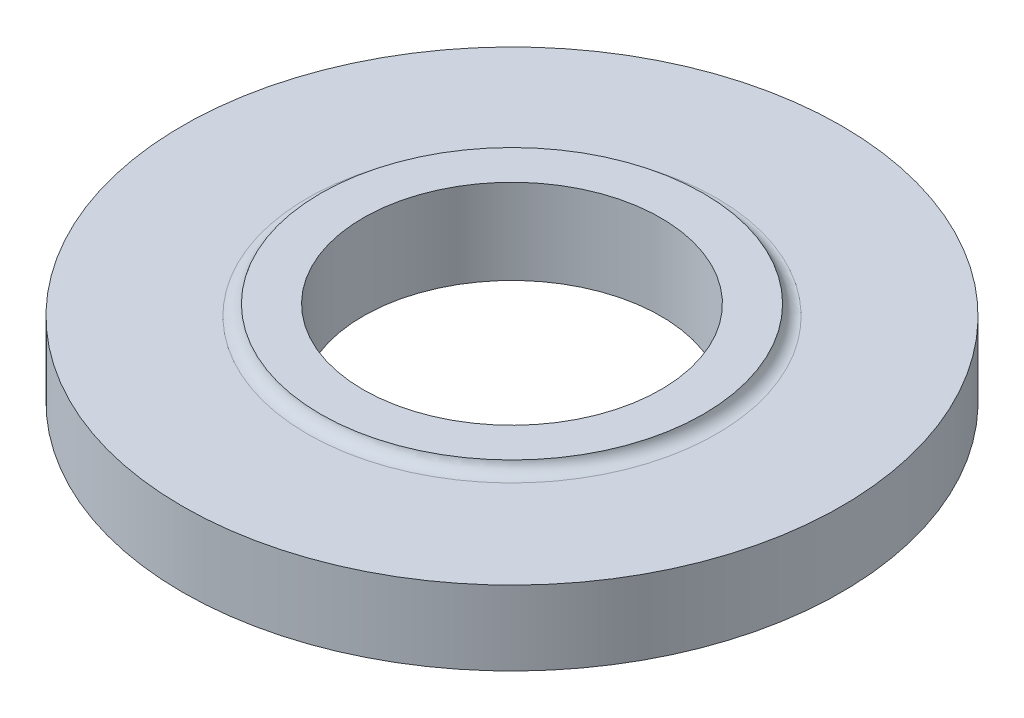
from build123d import *

# Parameters (mm, degrees)
SKETCH1_R           = 24.60625
BOSS_EXTRUDE1_DEPTH = 5.55625
SKETCH2_R           = 14.2875
BOSS_EXTRUDE2_DEPTH = 0.79375
SKETCH3_R           = 11.1125
CUT_EXTRUDE1_DEPTH  = 36.373119429
FILLET1_R           = 1


with BuildPart() as part:
    # Sketch1 → Boss-Extrude1 (new body)
    with BuildSketch(Plane(origin=(0, 0, 0), x_dir=(1, 0, 0), z_dir=(0, 1, 0))):
        with Locations(Location((0, 0, 0), (0, 0, 270))):
            Circle(SKETCH1_R)
    extrude(amount=BOSS_EXTRUDE1_DEPTH)

    # Sketch2 → Boss-Extrude2 (add)
    with BuildSketch(Plane(origin=(0, 5.55625, 0), x_dir=(1, 0, 0), z_dir=(0, 1, 0))):
        with Locations(Location((0, 0, 0), (0, 0, 270))):
            Circle(SKETCH2_R)
    extrude(amount=BOSS_EXTRUDE2_DEPTH)

    # Sketch3 → Cut-Extrude1 (cut, through all)
    with BuildSketch(Plane(origin=(0, 6.35, 0), x_dir=(1, 0, 0), z_dir=(0, 1, 0))):
        with Locations(Location((0, 0, 0), (0, 0, 270))):
            Circle(SKETCH3_R)
    extrude(amount=-CUT_EXTRUDE1_DEPTH, mode=Mode.SUBTRACT)

    # Fillet1
    # the kernel refuses this fillet: 1 mm, written as the material it adds along each edge
    with BuildSketch(Plane(origin=(0, 5.55625, 0), x_dir=(0, 0, 1), z_dir=(-1, 0, 0))) as fillet1_piece_1:
        with BuildLine():
            CenterArc((15.265999329, 1), FILLET1_R, 191.902682649, 78.097317351)
            Line((14.2875, 0.79375), (14.267930013, 0.789625))
            ThreePointArc((14.267930013, 0.789625), (14.2675, 0.396875), (14.2675, 0))
            Line((14.2675, 0), (14.2875, -0.02))
            Line((14.2875, -0.02), (15.265999329, -0.02))
            Line((15.265999329, -0.02), (15.265999329, 0))
        make_face()
    revolve(axis=Axis((0, 5.55625, 0), (0, 1, 0)))


solid = part.part
